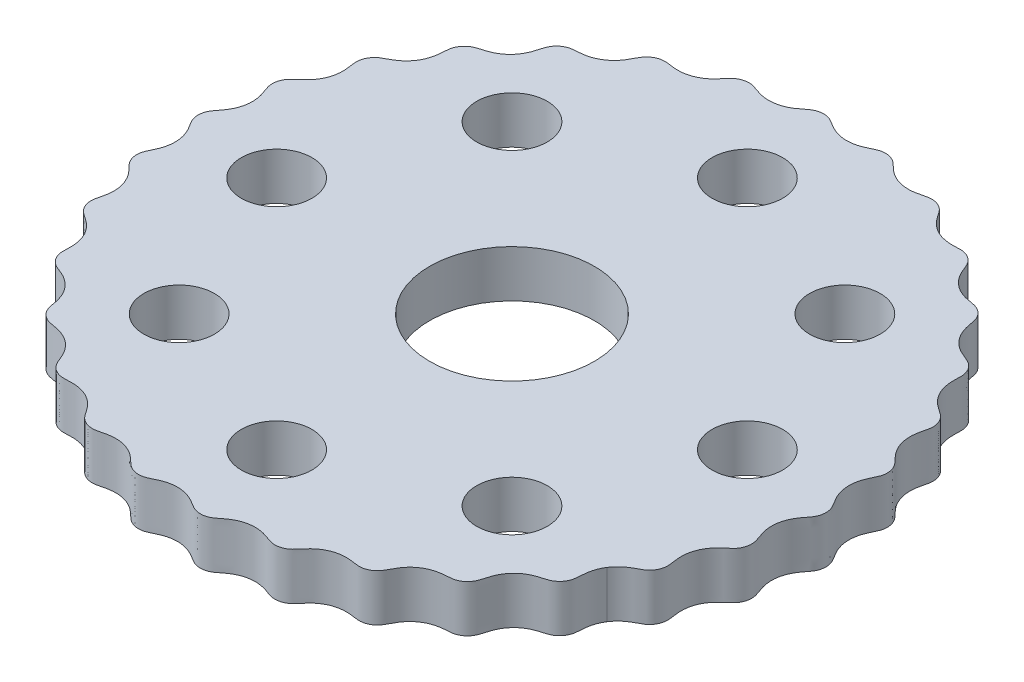
from build123d import *

# Parameters (mm, degrees)
BOSS_EXTRUDE1_DEPTH = 8
SKETCH3_R           = 14
SKETCH3_R_2         = 6
CUT_EXTRUDE1_DEPTH  = 80.49656613


# Read off the part's stored shape, not the designer's step: Boss-Extrude1
with BuildPart() as part:
    # Boss-Extrude1 outline → Boss-Extrude1 (new body)
    with BuildSketch(Plane(origin=(0, 0, 0), x_dir=(1, 0, 0), z_dir=(0, 1, 0))):
        with BuildLine():
            add(Edge.make_bspline(
                [(45.388971553, -29.254764763), (45.407199159, -29.226484843), (45.444379623, -29.170060531), (45.511937105, -29.070919406), (45.609111137, -28.935273588), (45.70604096, -28.807537805), (45.803093296, -28.68710606), (45.903242083, -28.569315432), (46.007049693, -28.453230826), (46.140878129, -28.310945037), (46.307023095, -28.146011319), (46.566287109, -27.909572663), (46.922763047, -27.624593159), (47.35417999, -27.330091553), (47.800787763, -27.071327246), (48.182564563, -26.8696117), (48.563600165, -26.666494355), (48.959766735, -26.437481334), (49.400582832, -26.09476385), (49.826377069, -25.584631737), (50.104832101, -25.044531461), (50.2543656, -24.541836612), (50.321349222, -24.054409018), (50.322179956, -23.59886052), (50.257456084, -23.097840788), (50.170192784, -22.549587261), (50.10058276, -21.960485301), (50.072351492, -21.330140089), (50.107317536, -20.661982723), (50.22372305, -19.964890658), (50.464751098, -19.136666364), (50.826397712, -18.3623522), (51.294372825, -17.660581751), (51.817666881, -17.070253729), (52.237597153, -16.669529714), (52.64714223, -16.319962614), (53.030562419, -16.004782748), (53.427631927, -15.640096044), (53.788975396, -15.182394454), (54.071819314, -14.622408836), (54.240369319, -13.974001699), (54.266060856, -13.341953598), (54.169619864, -12.756378532), (53.994893704, -12.232694985), (53.811047008, -11.75463414), (53.626251794, -11.234731445), (53.462572469, -10.666721551), (53.30893127, -9.883385), (53.263811711, -9.045617414), (53.344610916, -8.210951795), (53.548255815, -7.400992899), (53.781323283, -6.776288726), (54.068249139, -6.202727355), (54.393855425, -5.680355365), (54.742060995, -5.203985404), (55.093905261, -4.763137922), (55.450670744, -4.293105236), (55.741441386, -3.747488452), (55.921297876, -3.120738638), (55.959371647, -2.525017588), (55.89767666, -2.012796772), (55.76820652, -1.545540159), (55.592004438, -1.132571805), (55.336876251, -0.704858695), (55.037961523, -0.246631119), (54.73601899, 0.253880524), (54.452272245, 0.807080973), (54.207967035, 1.419382778), (54.022891699, 2.090670554), (53.89187899, 2.938034686), (53.891605458, 3.791473752), (54.019481401, 4.628133458), (54.248908557, 5.392707561), (54.467299939, 5.942012672), (54.702000508, 6.441373113), (54.931672749, 6.899187261), (55.156723279, 7.403295442), (55.309910556, 7.976647891), (55.346089118, 8.608182261), (55.24169114, 9.269954208), (55.014907453, 9.854893299), (54.700007259, 10.34570674), (54.340464824, 10.747440355), (53.989669983, 11.098570611), (53.616234634, 11.486475769), (53.237461556, 11.926307907), (52.774342364, 12.56493489), (52.377164888, 13.309067343), (52.092894401, 14.115007961), (51.933932289, 14.962818162), (51.88618558, 15.667946599), (51.916662138, 16.336325717), (52.006339379, 16.960894158), (52.133168612, 17.54038314), (52.273575252, 18.077479186), (52.386936932, 18.569793815), (52.430613635, 19.023223654), (52.411570713, 19.514896868), (52.31273581, 20.02521517), (52.092917669, 20.58178825), (51.731486021, 21.119311609), (51.296427803, 21.543124767), (50.823979292, 21.873468618), (50.364523998, 22.171002041), (49.892301259, 22.501510326), (49.421689481, 22.881633976), (48.847805757, 23.438116472), (48.236571682, 24.224587445), (47.77945793, 25.114157209), (47.495898187, 26.069006662), (47.377581327, 26.859586366), (47.342524075, 27.463523729), (47.34874378, 28.039884101), (47.374339813, 28.586665665), (47.380824586, 29.163113865), (47.289546324, 29.763581549), (47.062951222, 30.370391906), (46.738418659, 30.873156477), (46.381054733, 31.250627208), (45.992393894, 31.552368798), (45.59831004, 31.780851258), (45.132039902, 31.975316625), (44.613614935, 32.173865884), (44.068627964, 32.40813584), (43.508620204, 32.698857606), (42.947460285, 33.063218838), (42.401964556, 33.512574366), (41.805214722, 34.135423256), (41.315462661, 34.835775241), (40.941698898, 35.591938944), (40.692106978, 36.340288861), (40.555034858, 36.904321152), (40.457073415, 37.433781248), (40.375829771, 37.923422627), (40.258536503, 38.449638594), (40.042827181, 38.991421532), (39.699287139, 39.516365195), (39.222025476, 39.986536044), (38.687500942, 40.324811716), (38.132158567, 40.534075518), (37.591270556, 40.644605853), (37.085337577, 40.724409323), (36.542685228, 40.824343616), (35.968944215, 40.9665635), (35.372171575, 41.170967491), (34.764426671, 41.453278962), (34.049579612, 41.886787134), (33.405974818, 42.422953093), (32.850872552, 43.048754342), (32.405857977, 43.723109651), (32.116251315, 44.266285384), (31.877819199, 44.806021109), (31.671948389, 45.331153358), (31.443275091, 45.875136382), (31.116140158, 46.399760267), (30.663288581, 46.868895029), (30.166414981, 47.199728707), (29.691971774, 47.402409534), (29.222580351, 47.523913503), (28.776838406, 47.577802158), (28.278863788, 47.57071127), (27.732569796, 47.540957285), (27.148142704, 47.52972321), (26.527183734, 47.560591524), (25.87476221, 47.655167894), (25.200872297, 47.830531811), (24.401527067, 48.140753516), (23.662290374, 48.56723614), (23.001659755, 49.096309798), (22.454232708, 49.677286598), (22.087716198, 50.141071646), (21.772607641, 50.594008531), (21.490965071, 51.021817614), (21.166919844, 51.4687712), (20.746975696, 51.888111522), (20.218140168, 52.235210276), (19.592829866, 52.475684959), (18.972865921, 52.571754081), (18.390358932, 52.544449251), (17.862676211, 52.43394319), (17.383191082, 52.305711079), (16.860537703, 52.176259159), (16.290245378, 52.068148113), (15.505618617, 51.986388603), (14.662592287, 52.01448902), (13.822491994, 52.171273836), (13.008785752, 52.457513683), (12.374253231, 52.768728029), (11.81065819, 53.129311057), (11.314604652, 53.519258048), (10.876167073, 53.918839882), (10.48123156, 54.308983631), (10.111555421, 54.653315057), (9.740712009, 54.917855127), (9.305389048, 55.147200096), (8.814022981, 55.316765722), (8.222107488, 55.404684177), (7.575882789, 55.360436881), (6.991320731, 55.195572012), (6.469010318, 54.951591541), (5.981611183, 54.702458302), (5.459271261, 54.458755557), (4.894768655, 54.241255622), (4.125898843, 54.022498974), (3.139177978, 53.886390194), (2.140231086, 53.935302922), (1.171527315, 54.167157679), (0.427706748, 54.459982115), (-0.112846997, 54.731590322), (-0.608879887, 55.025156934), (-1.069608609, 55.320714539), (-1.565585017, 55.614554635), (-2.131244427, 55.835739204), (-2.770055169, 55.942907282), (-3.367728344, 55.913236135), (-3.873309546, 55.792485272), (-4.32895584, 55.606765922), (-4.723869377, 55.37972054), (-5.125416388, 55.073151454), (-5.556577561, 54.7234569), (-6.031954762, 54.36861932), (-6.563731055, 54.028999256), (-7.159857073, 53.72520112), (-7.821758215, 53.477465713), (-8.659536082, 53.272089615), (-9.510934726, 53.198127851), (-10.352673601, 53.252520765), (-11.125559627, 53.410542766), (-11.682562, 53.57385097), (-12.19006863, 53.753743918), (-12.65473234, 53.928205558), (-13.169095378, 54.089734602), (-13.746147845, 54.173816343), (-14.372532417, 54.138773772), (-15.018343162, 53.960538501), (-15.578560735, 53.6667645), (-16.037459715, 53.290455864), (-16.403625749, 52.877298216), (-16.725704151, 52.479049296), (-17.083575781, 52.059065462), (-17.493612592, 51.633301592), (-17.969017449, 51.218682529), (-18.517379524, 50.833516942), (-19.250230852, 50.431193226), (-20.036368832, 50.141901725), (-20.855876189, 49.974063872), (-21.662397355, 49.925855736), (-22.277596365, 49.946623357), (-22.864252135, 50.01002704), (-23.421940259, 50.094262965), (-24.007420063, 50.168282568), (-24.625262817, 50.147186169), (-25.258072323, 49.98973667), (-25.871207838, 49.685767499), (-26.381274713, 49.273564068), (-26.772919827, 48.78647412), (-27.05792603, 48.275429925), (-27.305442927, 47.787671847), (-27.587845257, 47.275792673), (-27.925107349, 46.753541564), (-28.33319371, 46.235767581), (-28.82202496, 45.739870887), (-29.490347556, 45.202712415), (-30.229317682, 44.775767311), (-31.017819662, 44.468173806), (-31.79467651, 44.284580734), (-32.379582958, 44.199058273), (-32.929392969, 44.152636102), (-33.440707329, 44.122630252), (-33.98980337, 44.065476064), (-34.562934692, 43.911463699), (-35.127948897, 43.627028227), (-35.648861186, 43.205730881), (-36.042041493, 42.716860985), (-36.309648303, 42.198742712), (-36.477788615, 41.686503072), (-36.606478927, 41.207140733), (-36.755696914, 40.689783654), (-36.947216226, 40.141840562), (-37.268723624, 39.421454003), (-37.714572684, 38.705422186), (-38.270402054, 38.056266086), (-38.925146682, 37.494696131), (-39.511931561, 37.100781279), (-40.106004785, 36.792986418), (-40.691732841, 36.558362808), (-41.257004196, 36.378459161), (-41.792338514, 36.23150073), (-42.275388321, 36.083526829), (-42.689891684, 35.894624009), (-43.106199199, 35.632316995), (-43.502151178, 35.288507021), (-43.879235889, 34.811867391), (-44.136136808, 34.278742939), (-44.264364625, 33.811303319), (-44.321411765, 33.429987074), (-44.347668663, 33.143196186), (-44.370338456, 32.784070873), (-44.396603487, 32.353089741), (-44.447661346, 31.839464476), (-44.537796267, 31.324940349), (-44.650057336, 30.882584416), (-44.758335787, 30.548817521), (-44.839921526, 30.32938567), (-44.914233904, 30.148739709), (-44.977083127, 30.006255805), (-45.042997115, 29.866399505), (-45.112595052, 29.728272424), (-45.188895554, 29.587240331), (-45.272306006, 29.442707087), (-45.334702464, 29.34022427), (-45.37073802, 29.283053874), (-45.388971553, 29.254764763)],
                knots=[0.06844298, 0.06844298, 0.06844298, 0.06844298, 0.06844298, 0.069168149, 0.069893435, 0.07061872, 0.071344006, 0.072069292, 0.072794577, 0.073519863, 0.074245149, 0.07569572, 0.077146291, 0.080047434, 0.082725049, 0.085402663, 0.086741471, 0.088080278, 0.090757893, 0.093909053, 0.097060213, 0.100336258, 0.10197428, 0.103612302, 0.106195127, 0.108777951, 0.111360776, 0.1139436, 0.117222902, 0.120502203, 0.123781505, 0.127060807, 0.133231863, 0.136317391, 0.139402919, 0.141712177, 0.144021435, 0.146330694, 0.148639952, 0.151722609, 0.154805266, 0.157908554, 0.161011842, 0.163395011, 0.165778179, 0.168161348, 0.170544517, 0.173654813, 0.176765109, 0.182985701, 0.186080294, 0.189174888, 0.192269482, 0.195364075, 0.197988566, 0.200613057, 0.203237548, 0.205862039, 0.208951025, 0.212040011, 0.215268845, 0.216883262, 0.218497679, 0.221043119, 0.223588558, 0.226133998, 0.228679437, 0.231910749, 0.23514206, 0.238373372, 0.241604684, 0.247825275, 0.25093557, 0.254045866, 0.256429034, 0.258812203, 0.261195371, 0.26357854, 0.266681827, 0.269785114, 0.272867772, 0.27595043, 0.278259688, 0.280568947, 0.282878205, 0.285187464, 0.288272992, 0.291358521, 0.297529578, 0.300808879, 0.30408818, 0.307367482, 0.310646783, 0.313229607, 0.315812431, 0.318395255, 0.32097808, 0.322616102, 0.324254124, 0.327530167, 0.330596191, 0.333662214, 0.336209236, 0.338756259, 0.341303282, 0.343850305, 0.346924598, 0.349998891, 0.356147477, 0.362296062, 0.365370355, 0.368444648, 0.37099167, 0.373538693, 0.376085715, 0.378632737, 0.38169876, 0.384764783, 0.388040827, 0.389678849, 0.391316872, 0.393899696, 0.396482521, 0.399065345, 0.40164817, 0.404927471, 0.408206773, 0.411486074, 0.414765376, 0.420936432, 0.42402196, 0.427107488, 0.429416747, 0.431726005, 0.434035263, 0.436344521, 0.439427179, 0.442509836, 0.445613124, 0.448716411, 0.45109958, 0.453482749, 0.455865918, 0.458249087, 0.461359382, 0.464469678, 0.467579974, 0.47069027, 0.476879457, 0.479974051, 0.483068644, 0.485693135, 0.488317626, 0.490942117, 0.493566608, 0.496655595, 0.499744581, 0.502973415, 0.504587832, 0.506202249, 0.508747688, 0.511293128, 0.513838567, 0.516384006, 0.519615318, 0.52284663, 0.526077941, 0.529309253, 0.535529844, 0.538640139, 0.541750435, 0.544133604, 0.546516772, 0.548899941, 0.55128311, 0.554386397, 0.557489684, 0.560572342, 0.563654999, 0.565964258, 0.568273516, 0.570582775, 0.572892033, 0.575977562, 0.57906309, 0.585234147, 0.588513448, 0.59179275, 0.595072051, 0.598351352, 0.600934176, 0.603517001, 0.606099825, 0.608682649, 0.610320671, 0.611958693, 0.615234737, 0.61830076, 0.621366783, 0.623913806, 0.626460829, 0.629007851, 0.631554874, 0.634629167, 0.63770346, 0.643852046, 0.650000631, 0.653074924, 0.656149217, 0.658696239, 0.661243262, 0.663790285, 0.666337307, 0.66940333, 0.672469353, 0.675745397, 0.677383419, 0.679021441, 0.681604266, 0.68418709, 0.686769915, 0.689352739, 0.69263204, 0.695911342, 0.699190643, 0.702469945, 0.708641001, 0.711726529, 0.714812058, 0.717121316, 0.719430574, 0.721739833, 0.724049091, 0.727131748, 0.730214406, 0.733317693, 0.736420981, 0.73880415, 0.741187319, 0.743570487, 0.745953656, 0.749063952, 0.752174247, 0.755284543, 0.758394839, 0.764584026, 0.76767862, 0.770773214, 0.773397705, 0.776022196, 0.778646687, 0.781271178, 0.784360164, 0.787449151, 0.790677985, 0.793906819, 0.796452258, 0.798997697, 0.801543136, 0.804088576, 0.807319887, 0.810551199, 0.81378251, 0.817013822, 0.823234413, 0.826344709, 0.829455004, 0.831838173, 0.834221342, 0.83660451, 0.838987679, 0.842090967, 0.845194254, 0.848276912, 0.851359569, 0.853668827, 0.855978086, 0.858287344, 0.860596603, 0.863682131, 0.866767659, 0.872938716, 0.876218017, 0.879497319, 0.88277662, 0.886055921, 0.888638746, 0.89122157, 0.893804395, 0.896387219, 0.898025241, 0.899663263, 0.902939307, 0.906090468, 0.909241628, 0.910580436, 0.911919243, 0.91325805, 0.914596858, 0.917274473, 0.919952088, 0.922853231, 0.924303802, 0.925754374, 0.926479659, 0.927204945, 0.927930231, 0.928655517, 0.929380802, 0.930106088, 0.930831374, 0.931556781, 0.931556781, 0.931556781, 0.931556781, 0.931556781], degree=4))
            add(Edge.make_bspline(
                [(-45.388971553, 29.254764763), (-45.407201914, 29.226480231), (-45.444384083, 29.1700529), (-45.511944865, 29.070906526), (-45.609122761, 28.935255181), (-45.706052554, 28.807519386), (-45.803104843, 28.687087594), (-45.903253466, 28.569296712), (-46.007060881, 28.453211795), (-46.140889301, 28.310926001), (-46.307037265, 28.145997459), (-46.566289384, 27.909538367), (-46.922791935, 27.624604603), (-47.354158368, 27.330016107), (-47.800845119, 27.071387485), (-48.182504911, 26.869470694), (-48.500208317, 26.700504852), (-48.750553128, 26.558146452), (-49.074268533, 26.348707221), (-49.44702123, 26.038872429), (-49.826452695, 25.584723194), (-50.104805501, 25.044447402), (-50.254394156, 24.541847659), (-50.321348749, 24.054370481), (-50.32219708, 23.598852541), (-50.257460348, 23.097811078), (-50.170205147, 22.54957195), (-50.100590048, 21.960461803), (-50.072361371, 21.330121628), (-50.107325348, 20.661961324), (-50.223731468, 19.964870928), (-50.464758501, 19.136645529), (-50.826405126, 18.362331865), (-51.294379638, 17.660560675), (-51.817673607, 17.070232612), (-52.23760364, 16.669508208), (-52.647148649, 16.319940991), (-53.030568709, 16.004760874), (-53.427638141, 15.64007405), (-53.788981469, 15.182372238), (-54.071825215, 14.622386573), (-54.240374954, 13.973979253), (-54.266066301, 13.341931356), (-54.169625054, 12.756356078), (-53.994898827, 12.23267315), (-53.811051745, 11.754611463), (-53.626256679, 11.234710655), (-53.46257648, 10.666697947), (-53.308936035, 9.88336686), (-53.263416995, 9.03821767), (-53.347051803, 8.188886057), (-53.560238833, 7.358376812), (-53.809977978, 6.708376903), (-54.112989291, 6.122878381), (-54.449328684, 5.60003256), (-54.798879286, 5.131432794), (-55.140869873, 4.70456631), (-55.488584629, 4.233939968), (-55.770441362, 3.676087573), (-55.935188191, 3.041313307), (-55.958795218, 2.357372429), (-55.840837009, 1.716026908), (-55.604879292, 1.144626276), (-55.295662596, 0.641982727), (-54.988619636, 0.168869257), (-54.688585497, -0.339229685), (-54.415592847, -0.890932621), (-54.126401866, -1.645365515), (-53.940797892, -2.461032738), (-53.879587012, -3.296470183), (-53.94332547, -4.13006052), (-54.067632104, -4.788544654), (-54.248894433, -5.392748852), (-54.467303861, -5.942023266), (-54.701993608, -6.441402127), (-54.931671429, -6.89920645), (-55.156718754, -7.403320037), (-55.309907613, -7.976669525), (-55.346084858, -8.608205827), (-55.241687321, -9.269976546), (-55.014903002, -9.854916275), (-54.700002932, -10.345729106), (-54.340460216, -10.747462852), (-53.989665367, -11.098592743), (-53.616229815, -11.48649781), (-53.237456597, -11.926329667), (-52.774337112, -12.5649564), (-52.377159291, -13.309088581), (-52.092888378, -14.115029051), (-51.933925826, -14.962839173), (-51.886178749, -15.667967651), (-51.916654979, -16.336346836), (-52.006331926, -16.960915375), (-52.133160905, -17.540404462), (-52.273567323, -18.077500613), (-52.38692883, -18.569815324), (-52.430605381, -19.023245216), (-52.411562283, -19.514918463), (-52.312727191, -20.025236744), (-52.092908846, -20.581809736), (-51.731477018, -21.119332941), (-51.296418693, -21.543145914), (-50.823970102, -21.873489564), (-50.36451472, -22.171022763), (-49.892291871, -22.501530803), (-49.421679952, -22.881654194), (-48.847796002, -23.438136356), (-48.236561539, -24.224606989), (-47.779447324, -25.114176515), (-47.495887079, -26.06902585), (-47.377569816, -26.859605565), (-47.34251227, -27.463542964), (-47.348731713, -28.03990339), (-47.374327513, -28.586685012), (-47.380812076, -29.163133264), (-47.289533601, -29.763600969), (-47.062938268, -30.37041127), (-46.738405516, -30.873175727), (-46.381041462, -31.250646316), (-45.992380548, -31.552387743), (-45.598296648, -31.780870049), (-45.132026476, -31.975335227), (-44.613601465, -32.173884245), (-44.068614432, -32.408153933), (-43.508606579, -32.698875403), (-42.947446525, -33.063236329), (-42.401950615, -33.512591535), (-41.80520046, -34.135440112), (-41.31544803, -34.835791837), (-40.941683846, -35.591955419), (-40.692091552, -36.340305242), (-40.555019124, -36.904337585), (-40.457057486, -37.433797566), (-40.375813543, -37.923439154), (-40.258520215, -38.449654812), (-40.042810473, -38.991438213), (-39.699270576, -39.516380979), (-39.222008181, -39.98655292), (-38.687484435, -40.324826368), (-38.1321406, -40.534093226), (-37.591255075, -40.644617728), (-37.085317437, -40.724431606), (-36.542673613, -40.824346097), (-35.968918413, -40.966599016), (-35.213716629, -41.225212008), (-34.459031178, -41.608359004), (-33.765313897, -42.10546528), (-33.152653891, -42.705330282), (-32.714626287, -43.246636051), (-32.359040809, -43.80175541), (-32.074470278, -44.354532497), (-31.843331413, -44.891427325), (-31.644808261, -45.401241981), (-31.445601194, -45.857690823), (-31.212430488, -46.24138509), (-30.907913205, -46.61869232), (-30.527379342, -46.967074085), (-30.020869053, -47.28295638), (-29.406585078, -47.501627763), (-28.793686845, -47.582888095), (-28.203822608, -47.56648111), (-27.640543825, -47.537092646), (-27.050517309, -47.531327454), (-26.436222642, -47.570747707), (-25.63827492, -47.697525025), (-24.83908029, -47.94461544), (-24.084967385, -48.30932737), (-23.394924717, -48.78131971), (-22.886814876, -49.218215607), (-22.454189269, -49.677294751), (-22.087708705, -50.141080521), (-21.772578593, -50.594016994), (-21.490947425, -51.021826131), (-21.16689586, -51.468779572), (-20.746955097, -51.888119825), (-20.218117219, -52.235218379), (-19.592808213, -52.475692847), (-18.972843392, -52.57176173), (-18.390336998, -52.544456708), (-17.86265402, -52.433950466), (-17.383169205, -52.305718169), (-16.860515802, -52.176266024), (-16.290223652, -52.068154718), (-15.50559696, -51.986394829), (-14.662570692, -52.014494811), (-13.822470315, -52.171279185), (-13.008763921, -52.457518611), (-12.374231181, -52.768732658), (-11.810635918, -53.129315437), (-11.314582149, -53.519262222), (-10.87614435, -53.918843888), (-10.481208636, -54.308987499), (-10.111532339, -54.653318815), (-9.740688807, -54.917858779), (-9.305365728, -55.147203613), (-8.813999585, -55.316769063), (-8.222084066, -55.404687299), (-7.575859411, -55.36043977), (-6.99129746, -55.195574715), (-6.468987181, -54.951594075), (-5.981588196, -54.702460648), (-5.459248431, -54.458757685), (-4.894745979, -54.241257498), (-4.125876343, -54.022500487), (-3.139155578, -53.886391202), (-2.140208661, -53.935303409), (-1.17150474, -54.167157674), (-0.427683963, -54.459981765), (0.112869961, -54.731589737), (0.608903028, -55.025156148), (1.069631917, -55.32071358), (1.565608475, -55.61455352), (2.131268009, -55.835737915), (2.770078818, -55.942905765), (3.367751988, -55.913234397), (3.873333132, -55.792483353), (4.328979323, -55.606763856), (4.723892749, -55.379718357), (5.125439614, -55.073149147), (5.5566006, -54.723454436), (6.0319776, -54.368616667), (6.563753683, -54.028996375), (7.159879504, -53.725197969), (7.821780457, -53.477462243), (8.659558213, -53.272085711), (9.510956817, -53.198123499), (10.352695797, -53.252515986), (11.12558193, -53.410537617), (11.6825845, -53.573845579), (12.19009113, -53.753738303), (12.654755169, -53.928199785), (13.169117971, -54.089728628), (13.746171046, -54.17381023), (14.372554775, -54.138767347), (15.018366821, -53.960531971), (15.578582091, -53.666757567), (16.03748442, -53.29044915), (16.403644207, -52.877290815), (16.725733862, -52.479042919), (17.083584247, -52.059056836), (17.493656468, -51.633296723), (18.095222751, -51.108579289), (18.804380479, -50.646576002), (19.581745771, -50.294352326), (20.407574095, -50.06370567), (21.09537247, -49.955015496), (21.753912677, -49.924629105), (22.374916989, -49.954572322), (22.955450952, -50.022847612), (23.496225067, -50.105828832), (23.991124784, -50.161534909), (24.439999304, -50.151450264), (24.919015328, -50.076384243), (25.410990256, -49.921023031), (25.937806544, -49.640313608), (26.43432498, -49.217663482), (26.811145289, -48.727508714), (27.091872855, -48.208466934), (27.348053065, -47.705960626), (27.638087444, -47.1920973), (27.979350807, -46.679816843), (28.383208991, -46.181622443), (28.855888113, -45.711356352), (29.509435823, -45.191375536), (30.236220304, -44.773069997), (31.017834651, -44.468161297), (31.794696788, -44.284566654), (32.379600311, -44.199044559), (32.929412102, -44.152621745), (33.440725536, -44.12261589), (33.989822113, -44.065461386), (34.562953137, -43.911448877), (35.127967448, -43.627013147), (35.648879462, -43.205715634), (36.042059656, -42.716845601), (36.309666204, -42.19872729), (36.477806375, -41.686487631), (36.606496406, -41.207125278), (36.755714258, -40.689768186), (36.947233118, -40.141825037), (37.268740441, -39.421438416), (37.714588578, -38.705406358), (38.270418408, -38.056250061), (38.925161611, -37.494679638), (39.51194826, -37.100764648), (40.106017955, -36.792969119), (40.691751668, -36.558345787), (41.257013472, -36.378440901), (41.792364247, -36.231483897), (42.275388953, -36.083507261), (42.689927414, -35.894607847), (43.106177781, -35.632294872), (43.502239155, -35.288495852), (43.879121799, -34.811835611), (44.167860031, -34.213366115), (44.297924714, -33.670358486), (44.342875745, -33.21497478), (44.370491948, -32.784066286), (44.396525375, -32.353061707), (44.447739425, -31.839452331), (44.537774351, -31.324918088), (44.650088067, -30.882567502), (44.758342994, -30.548798214), (44.839934685, -30.329366956), (44.914247053, -30.148720981), (44.977095912, -30.006237029), (45.0430096, -29.866380684), (45.112607475, -29.728253581), (45.188907953, -29.587221464), (45.272314843, -29.442694239), (45.334707526, -29.340216866), (45.370741197, -29.283049296), (45.388971553, -29.254764763)],
                knots=[0.068443102, 0.068443102, 0.068443102, 0.068443102, 0.068443102, 0.069168387, 0.069893673, 0.070618959, 0.071344245, 0.07206953, 0.072794816, 0.073520102, 0.074245388, 0.075695959, 0.077146531, 0.080047674, 0.082725289, 0.085402903, 0.086741711, 0.088080518, 0.089419326, 0.090758133, 0.093909294, 0.097060454, 0.100336498, 0.10197452, 0.103612542, 0.106195367, 0.108778191, 0.111361016, 0.11394384, 0.117223141, 0.120502443, 0.123781744, 0.127061045, 0.133232102, 0.13631763, 0.139403159, 0.141712417, 0.144021675, 0.146330934, 0.148640192, 0.15172285, 0.154805507, 0.157908795, 0.161012082, 0.163395251, 0.16577842, 0.168161588, 0.170544757, 0.173655053, 0.176765348, 0.182985939, 0.186217251, 0.189448562, 0.192679874, 0.195911186, 0.198456625, 0.201002064, 0.203547503, 0.206092942, 0.209321777, 0.212550611, 0.215639597, 0.218728583, 0.221353074, 0.223977565, 0.226602056, 0.229226547, 0.232321141, 0.235415735, 0.241604922, 0.244715218, 0.247825514, 0.25093581, 0.254046105, 0.256429274, 0.258812443, 0.261195612, 0.26357878, 0.266682068, 0.269785355, 0.272868013, 0.27595067, 0.278259929, 0.280569187, 0.282878445, 0.285187704, 0.288273232, 0.29135876, 0.297529817, 0.300809118, 0.304088419, 0.307367721, 0.310647022, 0.313229847, 0.315812671, 0.318395496, 0.32097832, 0.322616342, 0.324254364, 0.327530408, 0.330596431, 0.333662454, 0.336209477, 0.338756499, 0.341303522, 0.343850544, 0.346924837, 0.34999913, 0.356147715, 0.362296301, 0.365370594, 0.368444887, 0.37099191, 0.373538933, 0.376085955, 0.378632978, 0.381699001, 0.384765024, 0.388041068, 0.38967909, 0.391317112, 0.393899936, 0.396482761, 0.399065585, 0.401648409, 0.40492771, 0.408207012, 0.411486313, 0.414765614, 0.420936671, 0.4240222, 0.427107728, 0.429416986, 0.431726245, 0.434035503, 0.436344762, 0.439427419, 0.442510077, 0.445613364, 0.448716652, 0.45109982, 0.453482989, 0.455866158, 0.458249326, 0.461359622, 0.464469917, 0.470690508, 0.47392182, 0.477153132, 0.480384443, 0.483615755, 0.486161194, 0.488706634, 0.491252073, 0.493797512, 0.495411929, 0.497026346, 0.500255181, 0.503344167, 0.506433153, 0.509057644, 0.511682135, 0.514306626, 0.516931117, 0.52002571, 0.523120304, 0.529309491, 0.532419787, 0.535530083, 0.538640379, 0.541750675, 0.544133843, 0.546517012, 0.548900181, 0.55128335, 0.554386638, 0.557489925, 0.560572583, 0.56365524, 0.565964498, 0.568273756, 0.570583015, 0.572892273, 0.575977801, 0.579063329, 0.585234386, 0.588513687, 0.591792989, 0.59507229, 0.598351592, 0.600934416, 0.603517241, 0.606100065, 0.60868289, 0.610320912, 0.611958934, 0.615234978, 0.618301001, 0.621367024, 0.623914046, 0.626461069, 0.629008091, 0.631555114, 0.634629406, 0.637703699, 0.643852284, 0.65000087, 0.653075164, 0.656149457, 0.658696479, 0.661243502, 0.663790525, 0.666337548, 0.669403571, 0.672469594, 0.675745638, 0.67738366, 0.679021682, 0.681604506, 0.68418733, 0.686770154, 0.689352979, 0.69263228, 0.695911581, 0.699190882, 0.702470183, 0.70864124, 0.711726769, 0.714812297, 0.717121556, 0.719430814, 0.721740073, 0.724049331, 0.727131989, 0.730214647, 0.733317934, 0.736421221, 0.73880439, 0.741187559, 0.743570727, 0.745953896, 0.749064191, 0.752174487, 0.758395077, 0.761626389, 0.764857701, 0.768089013, 0.771320324, 0.773865764, 0.776411203, 0.778956642, 0.781502082, 0.783116499, 0.784730916, 0.78795975, 0.791048737, 0.794137723, 0.796762213, 0.799386704, 0.802011195, 0.804635686, 0.80773028, 0.810824873, 0.813919467, 0.81701406, 0.823234652, 0.826344948, 0.829455244, 0.831838413, 0.834221582, 0.836604751, 0.83898792, 0.842091207, 0.845194495, 0.848277152, 0.85135981, 0.853669068, 0.855978326, 0.858287584, 0.860596842, 0.86368237, 0.866767898, 0.872938955, 0.876218256, 0.879497558, 0.882776859, 0.886056161, 0.888638986, 0.89122181, 0.893804635, 0.896387459, 0.898025482, 0.899663504, 0.902939548, 0.906090708, 0.909241869, 0.911919483, 0.913258291, 0.914597098, 0.917274713, 0.919952327, 0.92285347, 0.924304041, 0.925754613, 0.926479898, 0.927205184, 0.92793047, 0.928655755, 0.929381041, 0.930106327, 0.930831612, 0.931556898, 0.931556898, 0.931556898, 0.931556898, 0.931556898], degree=4))
        make_face()
    extrude(amount=BOSS_EXTRUDE1_DEPTH)

    # Sketch3 → Cut-Extrude1 (cut, through all)
    with BuildSketch(Plane(origin=(0, 8, 0), x_dir=(1, 0, 0), z_dir=(0, 1, 0))):
        with Locations(Location((0, 0, 0), (0, 0, 270))):
            Circle(SKETCH3_R)
        with Locations(Location((0, 40, 0), (0, 0, 270))):
            Circle(SKETCH3_R_2)
        with Locations(Location((28.284271247, 28.284271247, 0), (0, 0, 270))):
            Circle(SKETCH3_R_2)
        with Locations(Location((40, 0, 0), (0, 0, 270))):
            Circle(SKETCH3_R_2)
        with Locations(Location((28.284271247, -28.284271247, 0), (0, 0, 270))):
            Circle(SKETCH3_R_2)
        with Locations(Location((0, -40, 0), (0, 0, 270))):
            Circle(SKETCH3_R_2)
        with Locations(Location((-28.284271247, -28.284271247, 0), (0, 0, 270))):
            Circle(SKETCH3_R_2)
        with Locations(Location((-40, 0, 0), (0, 0, 270))):
            Circle(SKETCH3_R_2)
        with Locations(Location((-28.284271247, 28.284271247, 0), (0, 0, 270))):
            Circle(SKETCH3_R_2)
    extrude(amount=-CUT_EXTRUDE1_DEPTH, mode=Mode.SUBTRACT)


solid = part.part
